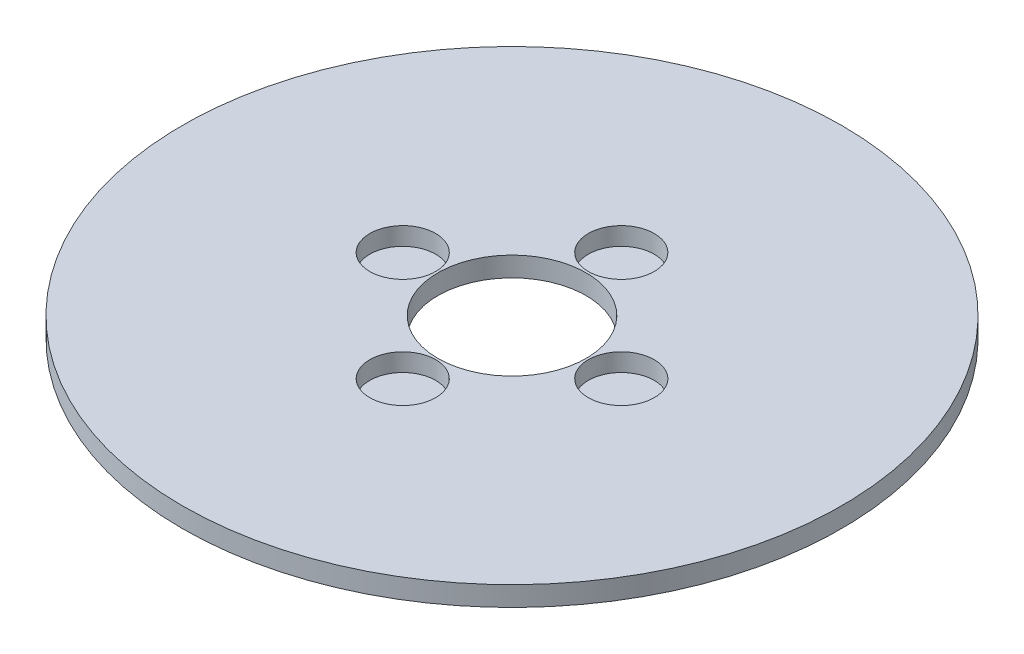
from build123d import *

# Parameters (mm, degrees)
SKETCH1_R           = 100
BOSS_EXTRUDE1_DEPTH = 6
SKETCH2_R           = 22.5
CUT_EXTRUDE1_DEPTH  = 142.548578234
SKETCH3_R           = 10
CUT_EXTRUDE2_DEPTH  = 5.452268863
CIRPATTERN1_COUNT   = 4


with BuildPart() as part:
    # Sketch1 → Boss-Extrude1 (new body)
    with BuildSketch(Plane(origin=(0, 0, 0), x_dir=(1, 0, 0), z_dir=(0, 1, 0))):
        Circle(SKETCH1_R)
    extrude(amount=BOSS_EXTRUDE1_DEPTH)

    # Sketch2 → Cut-Extrude1 (cut, through all)
    with BuildSketch(Plane(origin=(0, 0, 0), x_dir=(1, 0, 0), z_dir=(0, 1, 0))):
        Circle(SKETCH2_R)
    extrude(amount=CUT_EXTRUDE1_DEPTH, mode=Mode.SUBTRACT)

    # Sketch3 → Cut-Extrude2 (cut)
    with BuildSketch(Plane(origin=(0, 6, 0), x_dir=(1, 0, 0), z_dir=(0, 1, 0))):
        with Locations((-33.15718879, 0)):
            Circle(SKETCH3_R)
    cut_extrude2 = extrude(amount=-CUT_EXTRUDE2_DEPTH, mode=Mode.SUBTRACT)

    # CirPattern1: Cut-Extrude2 ×4 about axis
    cirpattern1_axis = Axis((0, 0, 0), (0, 1, 0))
    for i in range(1, CIRPATTERN1_COUNT):
        add(cut_extrude2.rotate(cirpattern1_axis, i * 360 / CIRPATTERN1_COUNT), mode=Mode.SUBTRACT)


solid = part.part
